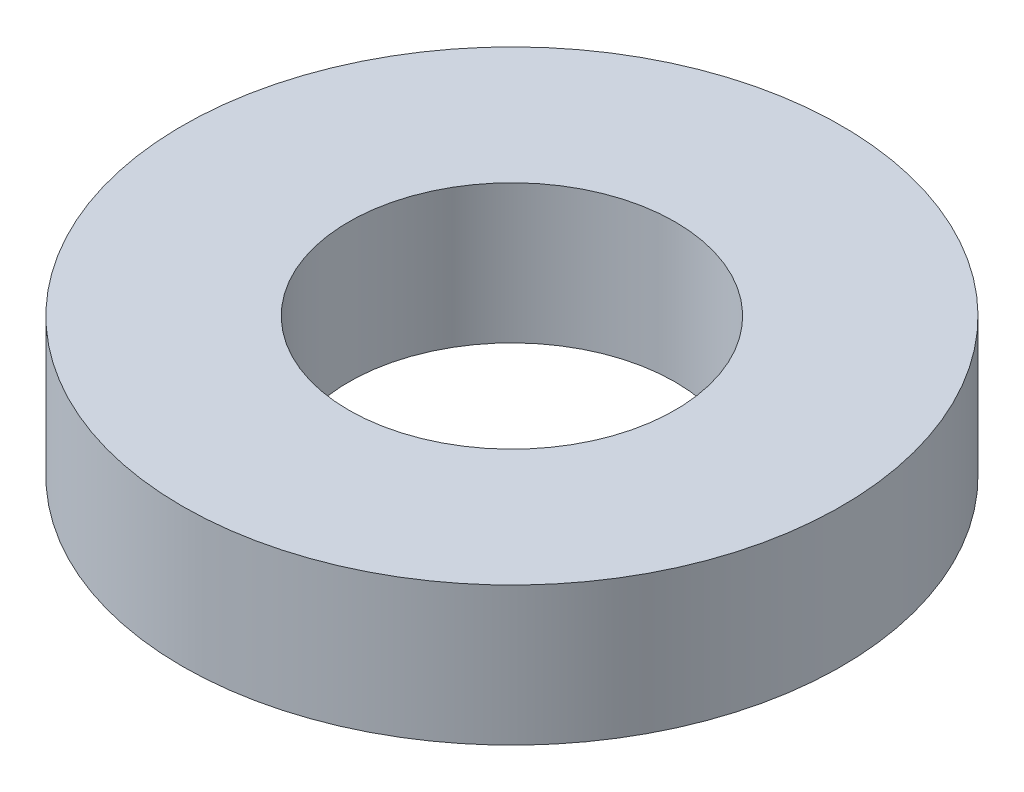
from build123d import *

# Parameters (mm, degrees)
SKETCH_1_R      = 40.4
SKETCH_1_R_2    = 20
EXTRUDE_1_DEPTH = 17


with BuildPart() as part:
    # 草图1 → 凸台-拉伸1 (new body)
    with BuildSketch(Plane(origin=(0, 0, 0), x_dir=(1, 0, 0), z_dir=(0, 1, 0))):
        Circle(SKETCH_1_R)
        Circle(SKETCH_1_R_2, mode=Mode.SUBTRACT)
    extrude(amount=EXTRUDE_1_DEPTH)


solid = part.part
